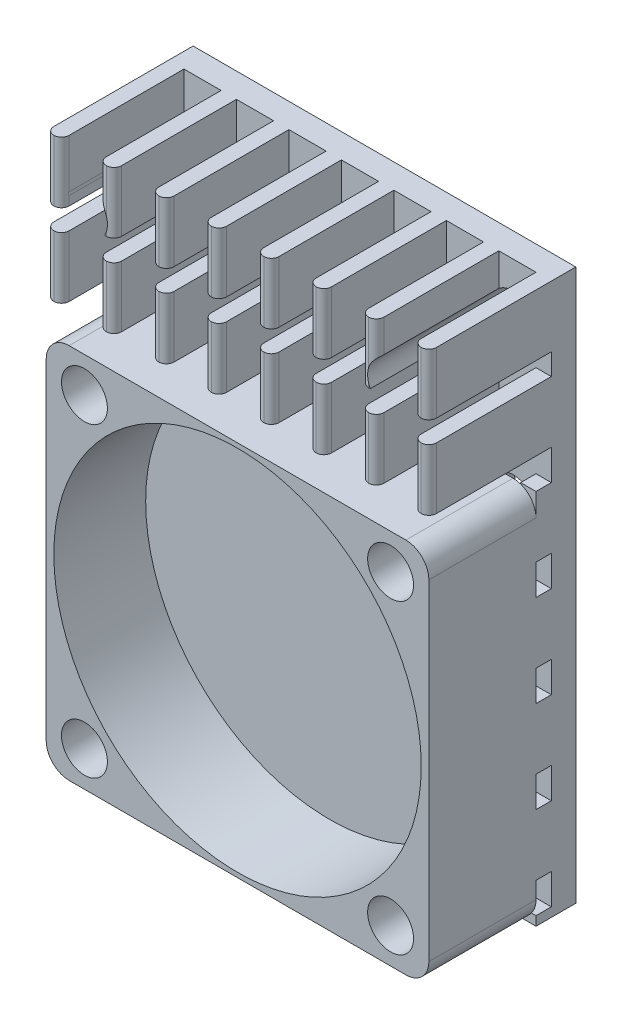
from build123d import *

# Parameters (mm, degrees)
SKETCH1_W           = 25
SKETCH1_H           = 36
BOSS_EXTRUDE1_DEPTH = 1.6
SKETCH2_W           = 1
SKETCH2_H           = 4
BOSS_EXTRUDE2_DEPTH = 8
FILLET1_R           = 0.5
SKETCH3_W           = 1
SKETCH3_H           = 4
SKETCH3_H_2         = 0.6
BOSS_EXTRUDE3_DEPTH = 1
BOSS_EXTRUDE4_DEPTH = 7
SKETCH6_R           = 12
CUT_EXTRUDE1_DEPTH  = 6
SKETCH7_R           = 1.5
CUT_EXTRUDE2_DEPTH  = 24.925091431
SKETCH8_R           = 1.5
CUT_EXTRUDE3_DEPTH  = 24.925091431


with BuildPart() as part:
    # Sketch1 → Boss-Extrude1 (new body)
    with BuildSketch(Plane.XY):
        Rectangle(SKETCH1_W, SKETCH1_H)
    extrude(amount=BOSS_EXTRUDE1_DEPTH)

    # Sketch2 → Boss-Extrude2 (add)
    with BuildSketch(Plane.XY.offset(1.6)):
        with Locations((8.572, 16)):
            Rectangle(SKETCH2_W, SKETCH2_H)
        with Locations((12, 16)):
            Rectangle(SKETCH2_W, SKETCH2_H)
        with Locations((5.144, 16)):
            Rectangle(SKETCH2_W, SKETCH2_H)
        with Locations((1.716, 16)):
            Rectangle(SKETCH2_W, SKETCH2_H)
        with Locations((-1.712, 16)):
            Rectangle(SKETCH2_W, SKETCH2_H)
        with Locations((-5.14, 16)):
            Rectangle(SKETCH2_W, SKETCH2_H)
        with Locations((-8.568, 16)):
            Rectangle(SKETCH2_W, SKETCH2_H)
        with Locations((-11.996, 16)):
            Rectangle(SKETCH2_W, SKETCH2_H)
        with Locations((-11.996, 10.6)):
            Rectangle(SKETCH2_W, SKETCH2_H)
        with Locations((-8.568, 10.6)):
            Rectangle(SKETCH2_W, SKETCH2_H)
        with Locations((-5.14, 10.6)):
            Rectangle(SKETCH2_W, SKETCH2_H)
        with Locations((-1.712, 10.6)):
            Rectangle(SKETCH2_W, SKETCH2_H)
        with Locations((1.716, 10.6)):
            Rectangle(SKETCH2_W, SKETCH2_H)
        with Locations((5.144, 10.6)):
            Rectangle(SKETCH2_W, SKETCH2_H)
        with Locations((8.572, 10.6)):
            Rectangle(SKETCH2_W, SKETCH2_H)
        with Locations((12, 10.6)):
            Rectangle(SKETCH2_W, SKETCH2_H)
    extrude(amount=BOSS_EXTRUDE2_DEPTH)

    # Fillet1
    fillet1_edges = [part.edges().sort_by_distance(p)[0] for p in [
        (-12.496, 16, 9.6),
        (-11.496, 16, 9.6),
        (-12.496, 10.6, 9.6),
        (-11.496, 10.6, 9.6),
        (-9.068, 16, 9.6),
        (-8.068, 16, 9.6),
        (-9.068, 10.6, 9.6),
        (-8.068, 10.6, 9.6),
        (-5.64, 16, 9.6),
        (-4.64, 16, 9.6),
        (-5.64, 10.6, 9.6),
        (-4.64, 10.6, 9.6),
        (-2.212, 16, 9.6),
        (-1.212, 16, 9.6),
        (-2.212, 10.6, 9.6),
        (-1.212, 10.6, 9.6),
        (1.216, 16, 9.6),
        (2.216, 16, 9.6),
        (1.216, 10.6, 9.6),
        (2.216, 10.6, 9.6),
        (4.644, 16, 9.6),
        (5.644, 16, 9.6),
        (4.644, 10.6, 9.6),
        (5.644, 10.6, 9.6),
        (8.072, 16, 9.6),
        (9.072, 16, 9.6),
        (8.072, 10.6, 9.6),
        (9.072, 10.6, 9.6),
        (12.5, 10.6, 9.6),
        (11.5, 10.6, 9.6),
        (11.5, 16, 9.6),
        (12.5, 16, 9.6),
    ]]
    fillet(fillet1_edges, radius=FILLET1_R - 0.0001)  # a hair under: the kernel refuses the full size

    # Sketch3 → Boss-Extrude3 (add)
    with BuildSketch(Plane.XY.offset(1.6)):
        with Locations((-11.996, 4.6)):
            Rectangle(SKETCH3_W, SKETCH3_H)
        with Locations((-8.568, 4.6)):
            Rectangle(SKETCH3_W, SKETCH3_H)
        with Locations((-5.14, 4.6)):
            Rectangle(SKETCH3_W, SKETCH3_H)
        with Locations((-1.712, 4.6)):
            Rectangle(SKETCH3_W, SKETCH3_H)
        with Locations((1.716, 4.6)):
            Rectangle(SKETCH3_W, SKETCH3_H)
        with Locations((5.144, 4.6)):
            Rectangle(SKETCH3_W, SKETCH3_H)
        with Locations((8.572, 4.6)):
            Rectangle(SKETCH3_W, SKETCH3_H)
        with Locations((12, 4.6)):
            Rectangle(SKETCH3_W, SKETCH3_H)
        with Locations((-11.996, -1.4)):
            Rectangle(SKETCH3_W, SKETCH3_H)
        with Locations((-8.568, -1.4)):
            Rectangle(SKETCH3_W, SKETCH3_H)
        with Locations((-5.14, -1.4)):
            Rectangle(SKETCH3_W, SKETCH3_H)
        with Locations((-1.712, -1.4)):
            Rectangle(SKETCH3_W, SKETCH3_H)
        with Locations((1.716, -1.4)):
            Rectangle(SKETCH3_W, SKETCH3_H)
        with Locations((5.144, -1.4)):
            Rectangle(SKETCH3_W, SKETCH3_H)
        with Locations((8.572, -1.4)):
            Rectangle(SKETCH3_W, SKETCH3_H)
        with Locations((12, -1.4)):
            Rectangle(SKETCH3_W, SKETCH3_H)
        with Locations((12, -7.4)):
            Rectangle(SKETCH3_W, SKETCH3_H)
        with Locations((8.572, -7.4)):
            Rectangle(SKETCH3_W, SKETCH3_H)
        with Locations((5.144, -7.4)):
            Rectangle(SKETCH3_W, SKETCH3_H)
        with Locations((1.716, -7.4)):
            Rectangle(SKETCH3_W, SKETCH3_H)
        with Locations((-1.712, -7.4)):
            Rectangle(SKETCH3_W, SKETCH3_H)
        with Locations((-5.14, -7.4)):
            Rectangle(SKETCH3_W, SKETCH3_H)
        with Locations((-8.568, -7.4)):
            Rectangle(SKETCH3_W, SKETCH3_H)
        with Locations((-11.996, -7.4)):
            Rectangle(SKETCH3_W, SKETCH3_H)
        with Locations((-11.996, -13.4)):
            Rectangle(SKETCH3_W, SKETCH3_H)
        with Locations((-8.568, -13.4)):
            Rectangle(SKETCH3_W, SKETCH3_H)
        with Locations((-5.14, -13.4)):
            Rectangle(SKETCH3_W, SKETCH3_H)
        with Locations((-1.712, -13.4)):
            Rectangle(SKETCH3_W, SKETCH3_H)
        with Locations((1.716, -13.4)):
            Rectangle(SKETCH3_W, SKETCH3_H)
        with Locations((5.144, -13.4)):
            Rectangle(SKETCH3_W, SKETCH3_H)
        with Locations((8.572, -13.4)):
            Rectangle(SKETCH3_W, SKETCH3_H)
        with Locations((12, -13.4)):
            Rectangle(SKETCH3_W, SKETCH3_H)
        with Locations((12, -17.7)):
            Rectangle(SKETCH3_W, SKETCH3_H_2)
        with Locations((8.572, -17.7)):
            Rectangle(SKETCH3_W, SKETCH3_H_2)
        with Locations((5.144, -17.7)):
            Rectangle(SKETCH3_W, SKETCH3_H_2)
        with Locations((1.716, -17.7)):
            Rectangle(SKETCH3_W, SKETCH3_H_2)
        with Locations((-1.712, -17.7)):
            Rectangle(SKETCH3_W, SKETCH3_H_2)
        with Locations((-5.14, -17.7)):
            Rectangle(SKETCH3_W, SKETCH3_H_2)
        with Locations((-8.568, -17.7)):
            Rectangle(SKETCH3_W, SKETCH3_H_2)
        with Locations((-11.996, -17.7)):
            Rectangle(SKETCH3_W, SKETCH3_H_2)
    extrude(amount=BOSS_EXTRUDE3_DEPTH)

    # Sketch5 → Boss-Extrude4 (add)
    with BuildSketch(Plane.XY.offset(2.6)):
        with BuildLine():
            Line((-10.996, 6.6), (11, 6.6))
            ThreePointArc((11, 6.6), (12.060660172, 6.160660172), (12.5, 5.1))
            Line((12.5, 5.1), (12.5, -16.5))
            ThreePointArc((12.5, -16.5), (12.060660172, -17.560660172), (11, -18))
            Line((11, -18), (-10.996, -18))
            ThreePointArc((-10.996, -18), (-12.056660172, -17.560660172), (-12.496, -16.5))
            Line((-12.496, -16.5), (-12.496, 5.1))
            ThreePointArc((-12.496, 5.1), (-12.056660172, 6.160660172), (-10.996, 6.6))
        make_face()
    extrude(amount=BOSS_EXTRUDE4_DEPTH)

    # Sketch6 → Cut-Extrude1 (cut)
    with BuildSketch(Plane.XY.offset(9.6)):
        with Locations((0.002, -5.7)):
            Circle(SKETCH6_R)
    extrude(amount=-CUT_EXTRUDE1_DEPTH, mode=Mode.SUBTRACT)

    # Sketch7 → Cut-Extrude2 (cut, through all)
    with BuildSketch(Plane.XY.offset(9.6)):
        with Locations((-9.998, 4.3)):
            Circle(SKETCH7_R)
        with Locations(Location((10.002, 4.3, 0), (0, 0, 180))):
            Circle(SKETCH7_R)
        with Locations((10.002, -15.7)):
            Circle(SKETCH7_R)
        with Locations(Location((-9.998, -15.7, 0), (0, 0, 180))):
            Circle(SKETCH7_R)
    extrude(amount=-CUT_EXTRUDE2_DEPTH, mode=Mode.SUBTRACT)

    # Sketch8 → Cut-Extrude3 (cut, through all)
    with BuildSketch(Plane(origin=(0, 0, 0), x_dir=(-1, 0, 0), z_dir=(0, 0, -1))):
        with Locations((-10, 14.7)):
            Circle(SKETCH8_R)
        with Locations(Location((10, 14.7, 0), (0, 0, 355.81477748))):
            Circle(SKETCH8_R)
    extrude(amount=-CUT_EXTRUDE3_DEPTH, mode=Mode.SUBTRACT)


solid = part.part
